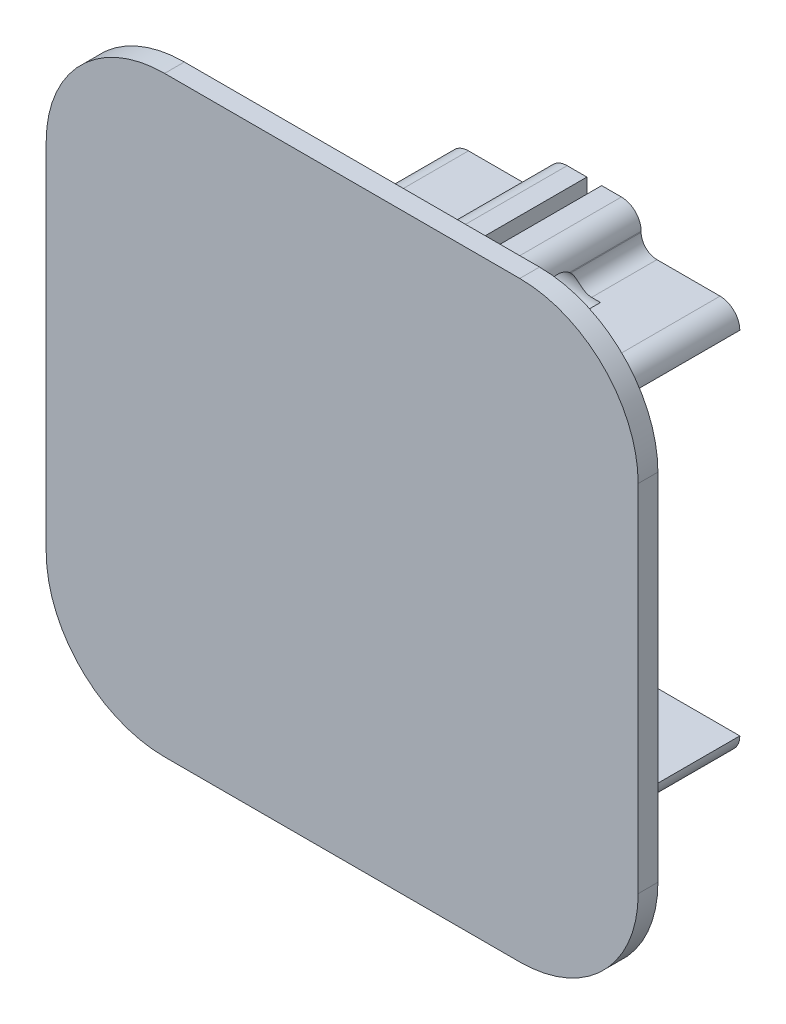
from build123d import *
from OCP.BRepFilletAPI import BRepFilletAPI_MakeFillet

# Parameters (mm, degrees)
SKETCH1_W           = 8.4
SKETCH1_H           = 23.5
BOSS_EXTRUDE1_DEPTH = 1
SKETCH1_3_W         = 11.6
SKETCH1_3_H         = 23.5
BOSS_EXTRUDE4_DEPTH = 1
BOSS_EXTRUDE5_START = -1
BOSS_EXTRUDE5_DEPTH = 9.4
FILLET2_R           = 1
FILLET2_R_2         = 0.8
FILLET3_R           = 5
CUT_EXTRUDE1_START  = -6
SKETCH4_R           = 0.902238409
CUT_EXTRUDE1_DEPTH  = 7
BOSS_EXTRUDE8_DEPTH = 1


# Read off the part's stored shape, not the designer's step: Mirror1
with BuildPart() as part:
    # Sketch1 → Boss-Extrude1 (new body)
    with BuildSketch(Plane.XY):
        Rectangle(SKETCH1_W, SKETCH1_H)
    extrude(amount=BOSS_EXTRUDE1_DEPTH)

    # Sketch1<3> → Boss-Extrude4 (add)
    with BuildSketch(Plane.XY):
        with Locations((-10, 0)):
            Rectangle(SKETCH1_3_W, SKETCH1_3_H)
    extrude(amount=BOSS_EXTRUDE4_DEPTH)

    # Sketch3 → Boss-Extrude5 (add)
    with BuildSketch(Plane(origin=(0, 0, 0), x_dir=(-1, 0, 0), z_dir=(0, 0, -1)).offset(BOSS_EXTRUDE5_START)):
        Polygon((0.05, 8.9), (7.05, 8.9), (7.05, 11.75), (5.05, 11.75), (5.05, 9.9), (0.05, 9.9), align=None)
        Polygon((7.8, 11.75), (7.8, 8.9), (14.8, 8.9), (14.8, 9.9), (9.8, 9.9), (9.8, 11.75), align=None)
    extrude(amount=BOSS_EXTRUDE5_DEPTH)

    # Fillet2
    fillet2_edges_1 = [part.edges().sort_by_distance(p)[0] for p in [
        (-9.8, 11.75, -4.2),
        (-5.05, 11.75, -4.2),
        (-0.05, 9.9, -4.2),
        (-14.8, 9.9, -4.2),
    ]]
    fillet2_edges_2 = [part.edges().sort_by_distance(p)[0] for p in [
        (-9.8, 9.9, -4.2),
        (-5.05, 9.9, -4.2),
    ]]
    fillet2 = BRepFilletAPI_MakeFillet(part.part.solid().wrapped)
    for e in fillet2_edges_1:
        fillet2.Add(FILLET2_R - 0.0001, e.wrapped)
    for e in fillet2_edges_2:
        fillet2.Add(FILLET2_R_2 - 0.0001, e.wrapped)
    add(Compound.cast(fillet2.Shape()), mode=Mode.REPLACE)  # a hair under: the kernel refuses the full size

    # Fillet3
    fillet3_edges = [part.edges().sort_by_distance(p)[0] for p in [
        (-15.8, 11.75, 0.5),
        (-15.8, -11.75, 0.5),
        (4.2, -11.75, 0.5),
        (4.2, 11.75, 0.5),
    ]]
    fillet(fillet3_edges, radius=FILLET3_R)

    # Sketch4 → Cut-Extrude1 (cut)
    with BuildSketch(Plane.ZY.offset(9.8).offset(CUT_EXTRUDE1_START)):
        with Locations(Location((-4.2, 10.05, 0), (0, 0, 189.57004168))):
            Circle(SKETCH4_R)
    extrude(amount=CUT_EXTRUDE1_DEPTH, mode=Mode.SUBTRACT)

    # Mirror1: part across plane


with BuildPart() as part_1:
    add(part.part)
    add(part.part.mirror(Plane.ZX))

    # Sketch7 → Boss-Extrude8 (add)
    with BuildSketch(Plane.XY):
        with BuildLine():
            Line((-1.8, 15), (-19.8, 15))
            ThreePointArc((-19.8, 15), (-24.042640687, 13.242640687), (-25.8, 9))
            Line((-25.8, 9), (-25.8, -9))
            ThreePointArc((-25.8, -9), (-24.042640687, -13.242640687), (-19.8, -15))
            Line((-19.8, -15), (-1.8, -15))
            ThreePointArc((-1.8, -15), (2.442640687, -13.242640687), (4.2, -9))
            Line((4.2, -9), (4.2, 9))
            ThreePointArc((4.2, 9), (2.442640687, 13.242640687), (-1.8, 15))
        make_face()
    extrude(amount=BOSS_EXTRUDE8_DEPTH)


solid = part_1.part
